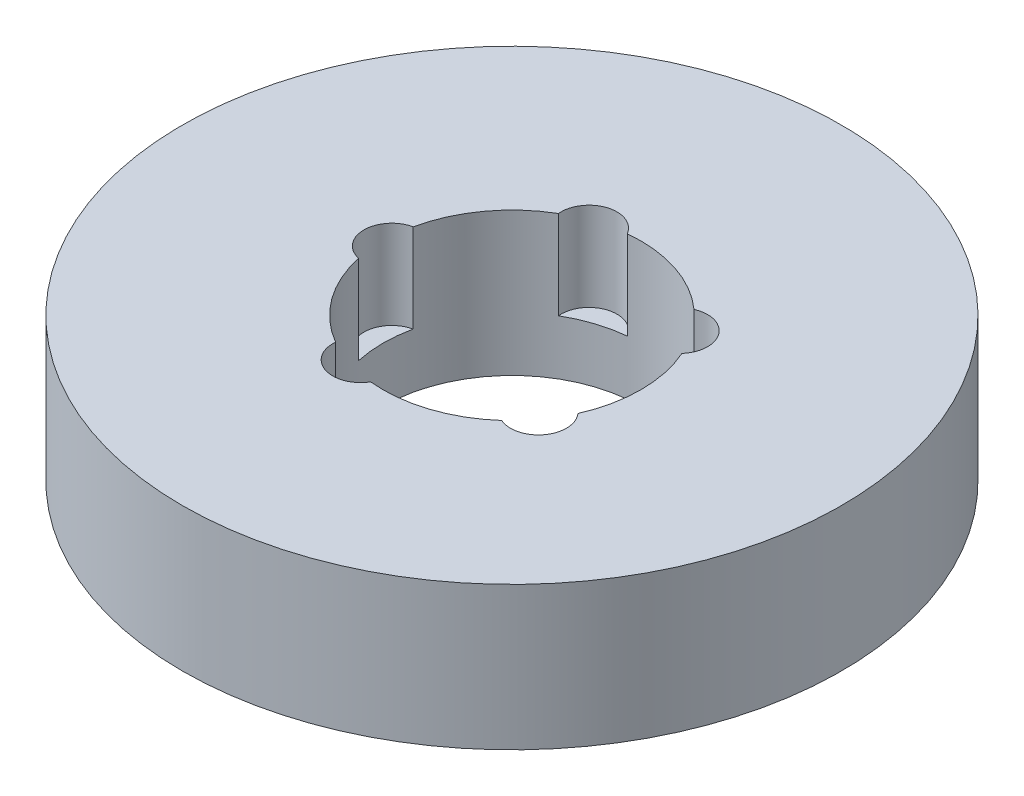
from build123d import *

# Parameters (mm, degrees)
SKETCH1_R           = 57.5
BOSS_EXTRUDE1_DEPTH = 25
SKETCH2_R           = 22.5
CUT_EXTRUDE1_DEPTH  = 86.073497636
SKETCH3_R           = 4.875508637
CUT_EXTRUDE2_DEPTH  = 15.454754419
CIRPATTERN1_COUNT   = 5


with BuildPart() as part:
    # Sketch1 → Boss-Extrude1 (new body)
    with BuildSketch(Plane(origin=(0, 0, 0), x_dir=(1, 0, 0), z_dir=(0, 1, 0))):
        Circle(SKETCH1_R)
    extrude(amount=BOSS_EXTRUDE1_DEPTH)

    # Sketch2 → Cut-Extrude1 (cut, through all)
    with BuildSketch(Plane(origin=(0, 0, 0), x_dir=(1, 0, 0), z_dir=(0, 1, 0))):
        Circle(SKETCH2_R)
    extrude(amount=CUT_EXTRUDE1_DEPTH, mode=Mode.SUBTRACT)

    # Sketch3 → Cut-Extrude2 (cut)
    with BuildSketch(Plane(origin=(0, 25, 0), x_dir=(1, 0, 0), z_dir=(0, 1, 0))):
        with Locations((-20.9481418, 0)):
            Circle(SKETCH3_R)
    cut_extrude2 = extrude(amount=-CUT_EXTRUDE2_DEPTH, mode=Mode.SUBTRACT)

    # CirPattern1: Cut-Extrude2 ×5 about axis
    cirpattern1_axis = Axis((0, 0, 0), (0, 1, 0))
    for i in range(1, CIRPATTERN1_COUNT):
        add(cut_extrude2.rotate(cirpattern1_axis, i * 360 / CIRPATTERN1_COUNT), mode=Mode.SUBTRACT)


solid = part.part
